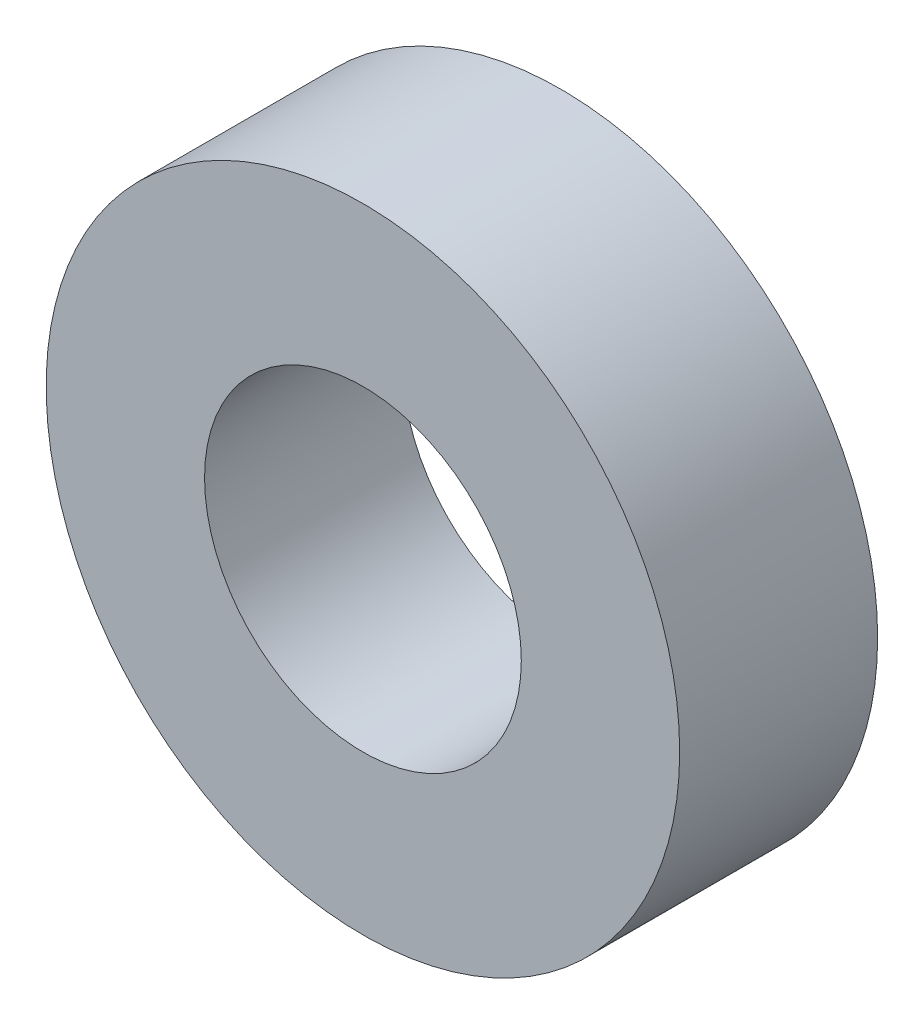
from build123d import *

# Parameters (mm, degrees)
SKETCH1_R           = 5.08
SKETCH1_R_2         = 2.54
BOSS_EXTRUDE1_DEPTH = 3.175


with BuildPart() as part:
    # Sketch1 → Boss-Extrude1 (new body)
    with BuildSketch(Plane.XY):
        Circle(SKETCH1_R)
        Circle(SKETCH1_R_2, mode=Mode.SUBTRACT)
    extrude(amount=BOSS_EXTRUDE1_DEPTH)


solid = part.part
